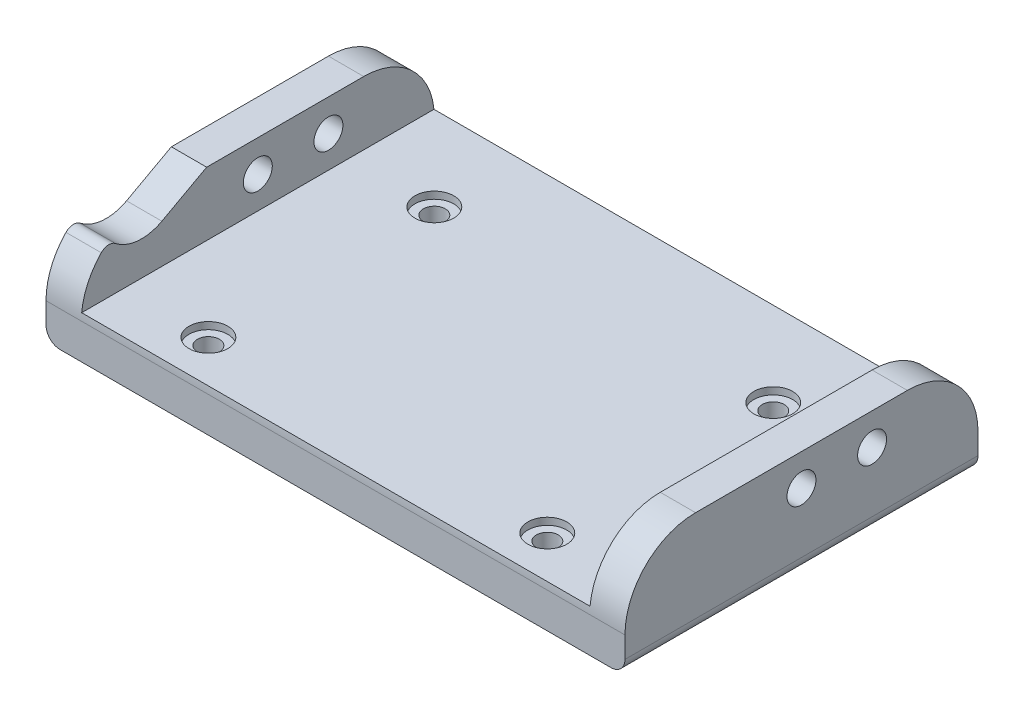
from build123d import *

# Parameters (mm, degrees)
SKETCH1_W           = 72
SKETCH1_H           = 40
BOSS_EXTRUDE1_DEPTH = 6
SKETCH3_W           = 40
SKETCH3_H           = 15
SKETCH3_R           = 2.05
BOSS_EXTRUDE2_DEPTH = 5
FILLET2_R           = 10
FILLET1_R           = 2
BOSS_EXTRUDE3_DEPTH = 10
SKETCH6_R           = 1.55
CUT_EXTRUDE2_DEPTH  = 10
SKETCH2_R           = 2.75
CUT_EXTRUDE1_DEPTH  = 1
FILLET3_R           = 10
CUT_EXTRUDE3_DEPTH  = 7
FILLET4_R           = 1.5


with BuildPart() as part:
    # Sketch1 → Boss-Extrude1 (new body)
    with BuildSketch(Plane(origin=(0, 0, 0), x_dir=(1, 0, 0), z_dir=(0, 1, 0))):
        Rectangle(SKETCH1_W, SKETCH1_H)
    extrude(amount=BOSS_EXTRUDE1_DEPTH)

    # Sketch3 → Boss-Extrude2 (add)
    with BuildSketch(Plane(origin=(36, 0, 0), x_dir=(0, 0, -1), z_dir=(1, 0, 0))):
        with Locations((0, 7.5)):
            Rectangle(SKETCH3_W, SKETCH3_H)
        with Locations((-5, 10.5)):
            Circle(SKETCH3_R, mode=Mode.SUBTRACT)
        with Locations((5, 10.5)):
            Circle(SKETCH3_R, mode=Mode.SUBTRACT)
    boss_extrude2 = extrude(amount=BOSS_EXTRUDE2_DEPTH)

    # Mirror1: Boss-Extrude2 across plane
    add(boss_extrude2.mirror(Plane.ZY))

    # Fillet2
    fillet2_edges = [part.edges().sort_by_distance(p)[0] for p in [
        (38.5, 15, -20),
    ]]
    fillet(fillet2_edges, radius=FILLET2_R)

    # Fillet1
    fillet1_edges = [part.edges().sort_by_distance(p)[0] for p in [
        (41, 0, 0),
        (-41, 0, 0),
    ]]
    fillet(fillet1_edges, radius=FILLET1_R)

    # Sketch5 → Boss-Extrude3 (add)
    with BuildSketch(Plane.XY.offset(20)):
        with BuildLine():
            Line((-41, 15), (-41, 2))
            ThreePointArc((-41, 2), (-40.414213562, 0.585786438), (-39, 0))
            Line((-39, 0), (39, 0))
            ThreePointArc((39, 0), (40.414213562, 0.585786438), (41, 2))
            Line((41, 2), (41, 15))
            Line((41, 15), (36, 15))
            Line((36, 15), (36, 6))
            Line((36, 6), (-36, 6))
            Line((-36, 6), (-36, 15))
            Line((-36, 15), (-41, 15))
        make_face()
    extrude(amount=BOSS_EXTRUDE3_DEPTH)

    # Sketch6 → Cut-Extrude2 (cut)
    with BuildSketch(Plane.XZ):
        with Locations((24, 24)):
            Circle(SKETCH6_R)
        with Locations((24, -8)):
            Circle(SKETCH6_R)
        with Locations((-24, 24)):
            Circle(SKETCH6_R)
        with Locations((-24, -8)):
            Circle(SKETCH6_R)
    extrude(amount=-CUT_EXTRUDE2_DEPTH, mode=Mode.SUBTRACT)

    # Sketch2 → Cut-Extrude1 (cut)
    with BuildSketch(Plane(origin=(0, 6, 0), x_dir=(1, 0, 0), z_dir=(0, 1, 0))):
        with Locations((-24, 8)):
            Circle(SKETCH2_R)
        with Locations((-24, -24)):
            Circle(SKETCH2_R)
        with Locations((24, -24)):
            Circle(SKETCH2_R)
        with Locations((24, 8)):
            Circle(SKETCH2_R)
    extrude(amount=-CUT_EXTRUDE1_DEPTH, mode=Mode.SUBTRACT)

    # Fillet3
    fillet3_edges = [part.edges().sort_by_distance(p)[0] for p in [
        (-38.5, 15, 30),
    ]]
    fillet(fillet3_edges, radius=FILLET3_R)

    # Sketch7 → Cut-Extrude3 (cut)
    with BuildSketch(Plane.ZY.offset(41)):
        with BuildLine():
            Line((12.245425122, 15), (18.589156814, 11.546259248))
            ThreePointArc((18.589156814, 11.546259248), (22.57380679, 10.92053449), (26.05426141, 12.959014938))
            ThreePointArc((26.05426141, 12.959014938), (23.194514879, 14.476026313), (20, 15))
            Line((20, 15), (12.245425122, 15))
        make_face()
        Polygon((-20, 5), (-20.731407815, 5), (-20.180729163, 0), (-19.449321347, 0), align=None)
    extrude(amount=-CUT_EXTRUDE3_DEPTH, mode=Mode.SUBTRACT)

    # Fillet4
    fillet4_edges = [part.edges().sort_by_distance(p)[0] for p in [
        (-38.5, 12.959014938, 26.05426141),
    ]]
    fillet(fillet4_edges, radius=FILLET4_R)


solid = part.part
